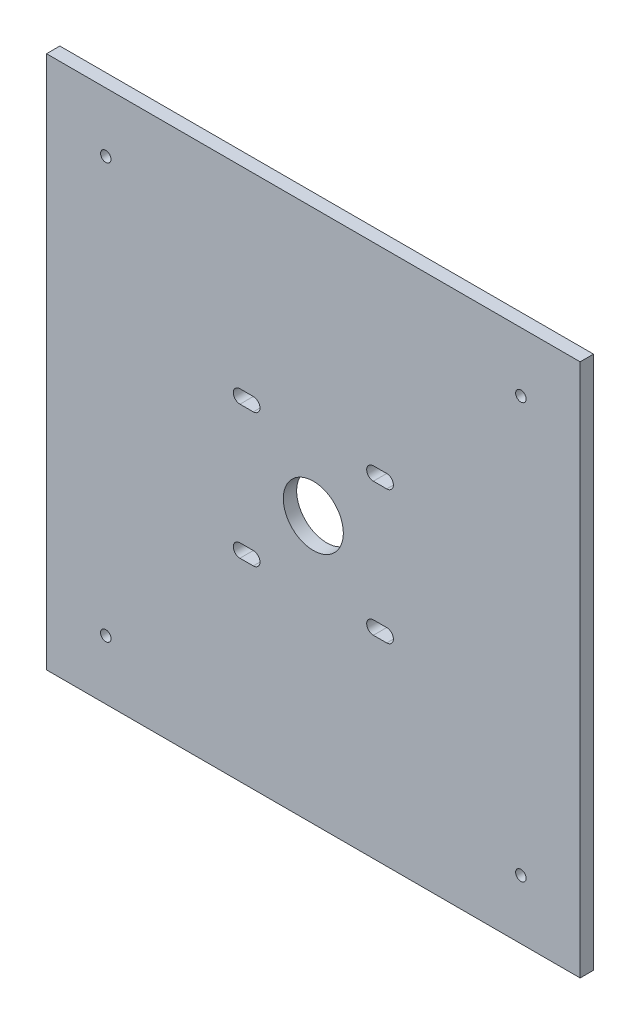
from build123d import *

# Parameters (mm, degrees)
SKETCH1_W                      = 254
SKETCH1_H                      = 254
SKETCH1_R                      = 14.2875
BOSS_EXTRUDE2_DEPTH            = 6.35
F_9_0_196_DIAMETER_HOLE1_D     = 4.9784
F_9_0_196_DIAMETER_HOLE1_DEPTH = 6.35
F_9_0_196_DIAMETER_HOLE1_TIP   = 1.495662253
CUT_EXTRUDE1_DEPTH             = 6.35


with BuildPart() as part:
    # Sketch1 → Boss-Extrude2 (new body)
    with BuildSketch(Plane.XY):
        Rectangle(SKETCH1_W, SKETCH1_H)
        Circle(SKETCH1_R, mode=Mode.SUBTRACT)
    extrude(amount=BOSS_EXTRUDE2_DEPTH)

    # #9 (0.196) Diameter Hole1
    with Locations(Plane(origin=(0, 0, 0), x_dir=(-1, 0, 0), z_dir=(0, 0, -1))):
        with Locations((-98.782817332, 98.782817332), (98.782817332, 98.782817332), (98.782817332, -98.782817332), (-98.782817332, -98.782817332)):
            Hole(F_9_0_196_DIAMETER_HOLE1_D / 2, depth=F_9_0_196_DIAMETER_HOLE1_DEPTH)
            with Locations((0, 0, -(F_9_0_196_DIAMETER_HOLE1_DEPTH + F_9_0_196_DIAMETER_HOLE1_TIP / 2))):  # 118° drill point
                Cone(0, F_9_0_196_DIAMETER_HOLE1_D / 2, F_9_0_196_DIAMETER_HOLE1_TIP, mode=Mode.SUBTRACT)

    # Sketch4 → Cut-Extrude1 (cut)
    with BuildSketch(Plane.XY.offset(6.35)):
        with BuildLine():
            Line((-34.925, 34.925), (-28.575, 34.925))
            ThreePointArc((-28.575, 34.925), (-25.4, 31.75), (-28.575, 28.575))
            Line((-28.575, 28.575), (-34.925, 28.575))
            ThreePointArc((-34.925, 28.575), (-38.1, 31.75), (-34.925, 34.925))
        make_face()
        with BuildLine():
            Line((-34.925, -28.575), (-28.575, -28.575))
            ThreePointArc((-28.575, -28.575), (-25.4, -31.75), (-28.575, -34.925))
            Line((-28.575, -34.925), (-34.925, -34.925))
            ThreePointArc((-34.925, -34.925), (-38.1, -31.75), (-34.925, -28.575))
        make_face()
        with BuildLine():
            Line((28.575, -28.575), (34.925, -28.575))
            ThreePointArc((34.925, -28.575), (38.1, -31.75), (34.925, -34.925))
            Line((34.925, -34.925), (28.575, -34.925))
            ThreePointArc((28.575, -34.925), (25.4, -31.75), (28.575, -28.575))
        make_face()
        with BuildLine():
            Line((28.575, 34.925), (34.925, 34.925))
            ThreePointArc((34.925, 34.925), (38.1, 31.75), (34.925, 28.575))
            Line((34.925, 28.575), (28.575, 28.575))
            ThreePointArc((28.575, 28.575), (25.4, 31.75), (28.575, 34.925))
        make_face()
    extrude(amount=-CUT_EXTRUDE1_DEPTH, mode=Mode.SUBTRACT)


solid = part.part
